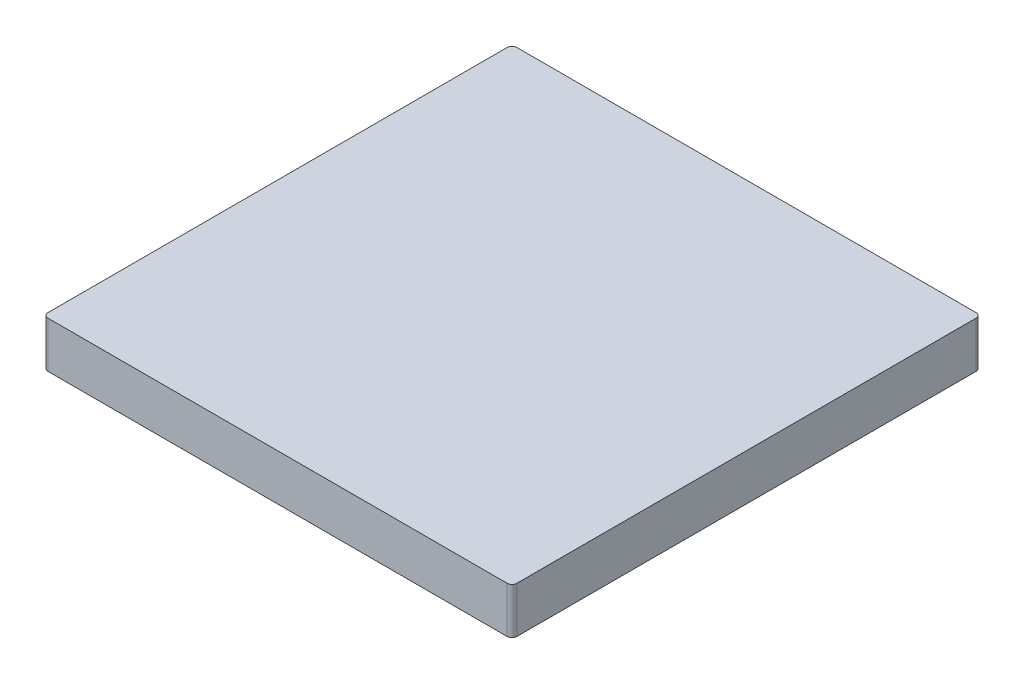
from build123d import *

# Parameters (mm, degrees)
SKETCH1_W           = 96.825
SKETCH1_H           = 96.825
BOSS_EXTRUDE1_DEPTH = 4.7625
FILLET1_R           = 1


with BuildPart() as part:
    # Sketch1 → Boss-Extrude1 (new, symmetric)
    with BuildSketch(Plane(origin=(0, 0, 0), x_dir=(1, 0, 0), z_dir=(0, 1, 0))):
        Rectangle(SKETCH1_W, SKETCH1_H)
    extrude(amount=BOSS_EXTRUDE1_DEPTH, both=True)

    # Fillet1
    fillet1_edges = [part.edges().sort_by_distance(p)[0] for p in [
        (-48.4125, 0, -48.4125),
        (48.4125, 0, -48.4125),
        (48.4125, 0, 48.4125),
        (-48.4125, 0, 48.4125),
    ]]
    fillet(fillet1_edges, radius=FILLET1_R)


solid = part.part
